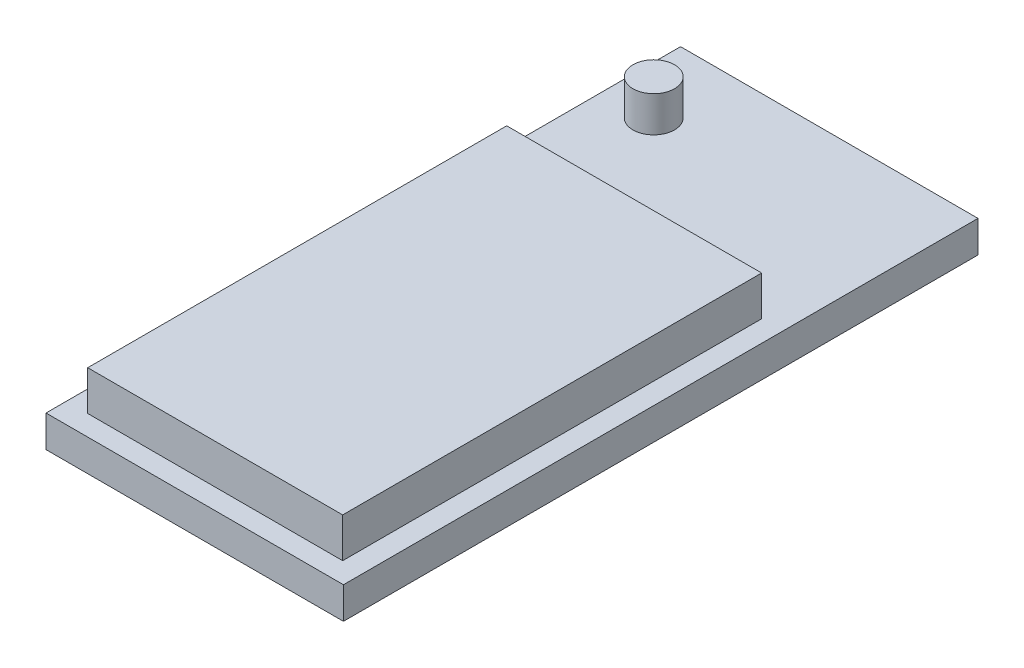
from build123d import *

# Parameters (mm, degrees)
SKETCH_1_W      = 15
SKETCH_1_H      = 32
EXTRUDE_1_DEPTH = 1.6
SKETCH_2_W      = 12.857079129
SKETCH_2_H      = 21.128766401
EXTRUDE_2_DEPTH = 2
SKETCH_3_R      = 1.048746982
EXTRUDE_3_DEPTH = 1.8


with BuildPart() as part:
    # 草图1 → 凸台-拉伸1 (new body)
    with BuildSketch(Plane(origin=(0, 0, 0), x_dir=(1, 0, 0), z_dir=(0, 1, 0))):
        Rectangle(SKETCH_1_W, SKETCH_1_H)
    extrude(amount=EXTRUDE_1_DEPTH)

    # 草图2 → 凸台-拉伸2 (add)
    with BuildSketch(Plane(origin=(0, 1.6, 0), x_dir=(1, 0, 0), z_dir=(0, 1, 0))):
        with Locations((0.002075323, -4.405572569)):
            Rectangle(SKETCH_2_W, SKETCH_2_H)
    extrude(amount=EXTRUDE_2_DEPTH)

    # 草图3 → 凸台-拉伸3 (add)
    with BuildSketch(Plane(origin=(0, 1.6, 0), x_dir=(1, 0, 0), z_dir=(0, 1, 0))):
        with Locations((-5.062783927, 12.209984483)):
            Circle(SKETCH_3_R)
    extrude(amount=EXTRUDE_3_DEPTH)


solid = part.part
